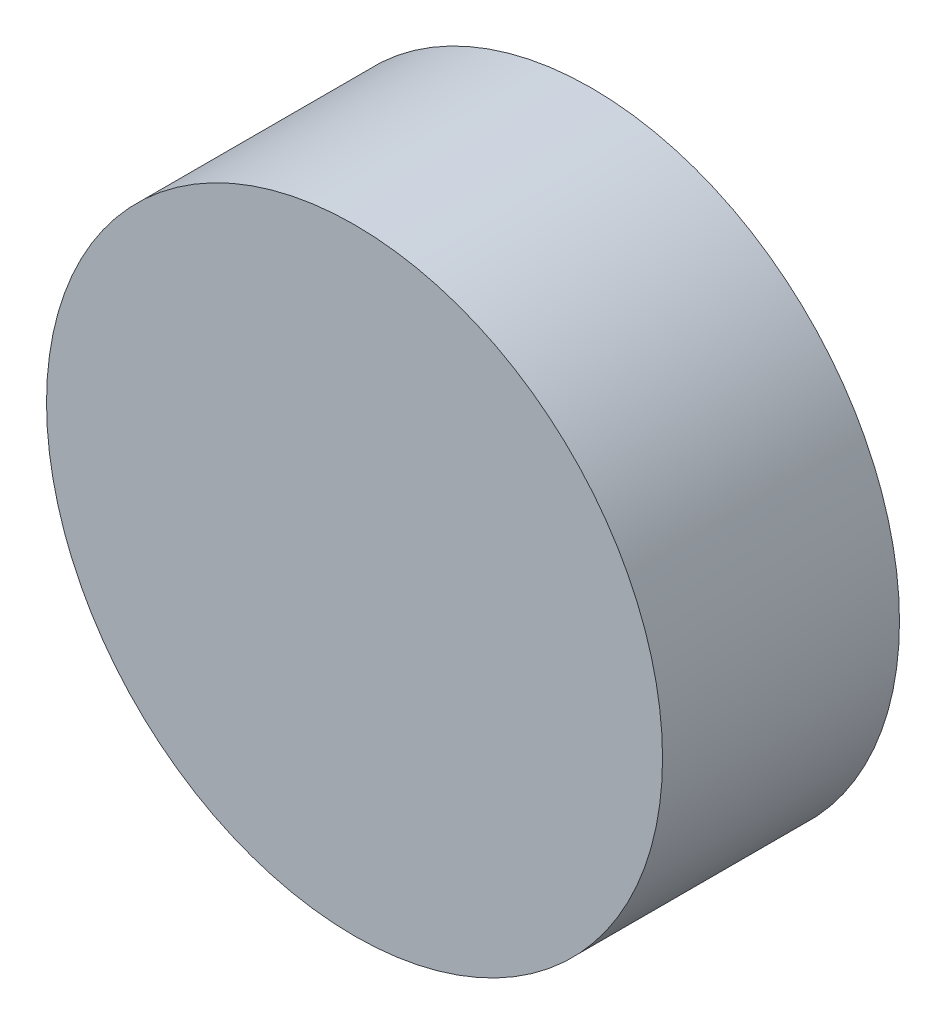
from build123d import *

# Parameters (mm, degrees)
SKETCH_1_R           = 32.5
CS_RIGHT_WHEEL_DEPTH = 25


with BuildPart() as part:
    # Эскиз1 → CS_RIGHT_WHEEL (new body)
    with BuildSketch(Plane.XY):
        Circle(SKETCH_1_R)
    extrude(amount=CS_RIGHT_WHEEL_DEPTH)


solid = part.part
